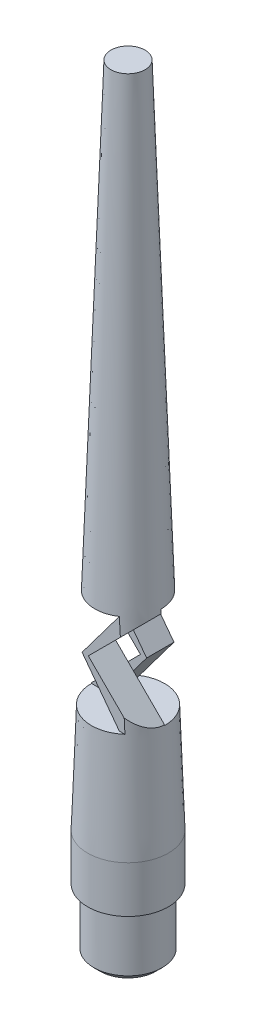
from build123d import *

# Parameters (mm, degrees)
CHAMFER1_SIZE           = 0.254
CUT_EXTRUDE1_DEPTH      = 2.54
CUT_EXTRUDE2_DEPTH      = 1.49577718
CUT_EXTRUDE3_DEPTH      = 32.835736241
CUT_EXTRUDE3_DEPTH_BACK = 32.835736241
SKETCH9_W               = 0.424246117
SKETCH9_H               = 4.064


# Read off the part's stored shape, not the designer's step: Cut-Extrude2
with BuildPart() as part:
    # Sketch1 → Revolve1 (revolve)
    with BuildSketch(Plane.XY, mode=Mode.PRIVATE) as revolve1_sk:
        Polygon((0, 0), (0, 31.75), (-0.697488389, 31.75), (-1.651, 4.445), (-1.651, 2.54), (-1.397, 2.54), (-1.397, 0), align=None)
    revolve(revolve1_sk.sketch.rotate(Axis((0, 0, 0), (0, 1, 0)), 270), axis=Axis((0, 0, 0), (0, 1, 0)))

    # Chamfer1
    chamfer1_edges = [part.edges().sort_by_distance(p)[0] for p in [
        (0, 0, 1.397),
    ]]
    chamfer(chamfer1_edges, length=CHAMFER1_SIZE)

    # Sketch7 → Cut-Extrude1 (cut)
    with BuildSketch(Plane.XY):
        Polygon((-1.778, 13.208), (0.508, 10.922), (-1.778, 8.636), align=None)
        Polygon((-0.762, 12.954), (2.54, 12.954), (2.54, 8.89), (-0.762, 8.89), (0.762, 10.922), align=None)
    extrude(amount=-CUT_EXTRUDE1_DEPTH, mode=Mode.SUBTRACT)

    # Cut-Extrude2 outline → Cut-Extrude2 (cut)
    with BuildSketch(Plane.XY):
        Polygon((-0.508, 10.922), (1.778, 8.636), (1.778, 13.208), align=None)
        Polygon((-2.54, 8.89), (0.762, 8.89), (-0.762, 10.922), (0.762, 12.954), (-2.54, 12.954), align=None)
    extrude(amount=CUT_EXTRUDE2_DEPTH, mode=Mode.SUBTRACT)

    # Sketch9 → Cut-Extrude3 (cut, two sides: drawn at the far end of the back side and taken through both)
    with BuildSketch(Plane(origin=(0, 0, 0), x_dir=(0, 0, -1), z_dir=(1, 0, 0)).offset(-CUT_EXTRUDE3_DEPTH_BACK)):
        with Locations((-1.331180992, 10.922)):
            Rectangle(SKETCH9_W, SKETCH9_H)
        with Locations((1.331180992, 10.922)):
            Rectangle(SKETCH9_W, SKETCH9_H)
    extrude(amount=CUT_EXTRUDE3_DEPTH + CUT_EXTRUDE3_DEPTH_BACK, mode=Mode.SUBTRACT)


solid = part.part
